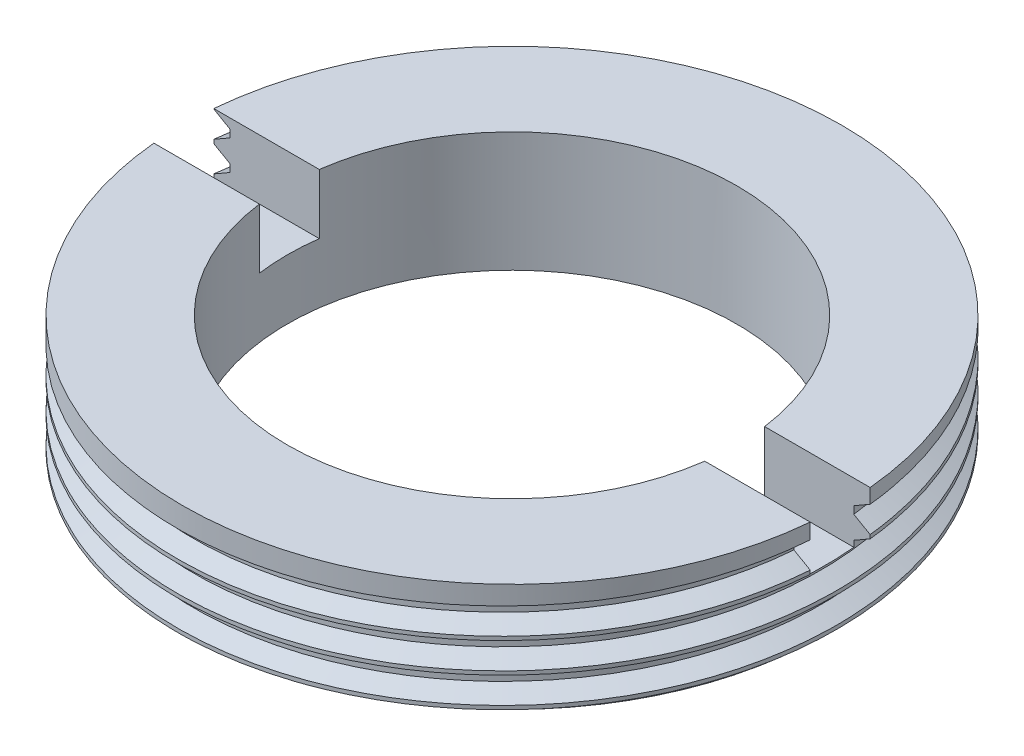
from build123d import *

# Parameters (mm, degrees)
SKETCH_1_R          = 11
SKETCH_1_R_2        = 7.5
EXTRUDE_1_DEPTH     = 4
THREAD_1_PITCH      = 1
SKETCH_4_W          = 24
SKETCH_4_H          = 2
CUT_EXTRUDE_1_DEPTH = 2


with BuildPart() as part:
    # Sketch 1 → Бобышка-Вытянуть1 (new body)
    with BuildSketch(Plane(origin=(0, 0, 0), x_dir=(1, 0, 0), z_dir=(0, 1, 0))):
        with Locations(Location((0, 0, 0), (0, 0, 270))):
            Circle(SKETCH_1_R)
        with Locations(Location((0, 0, 0), (0, 0, 270))):
            Circle(SKETCH_1_R_2, mode=Mode.SUBTRACT)
    extrude(amount=EXTRUDE_1_DEPTH)

    # Резьба1: the profile of Sketch 1 2 profile screwed along a right-hand helix of 4 turns, 8 arcs to a turn; built about Z, then put on its axis
    thread_1_z = Axis((0, 0, 0), (0, 0, 1))
    thread_1_corners = [(11.0003, 0, -0.000173205), (11.0003, 0, 0.875173202), (10.458734125, 0, 0.562499999), (10.458734125, 0, 0.312499999)]
    with BuildLine(mode=Mode.PRIVATE) as thread_1_profile:
        Line(thread_1_corners[0], thread_1_corners[1])
        Line(thread_1_corners[1], thread_1_corners[2])
        Line(thread_1_corners[2], thread_1_corners[3])
        Line(thread_1_corners[3], thread_1_corners[0])
    thread_1_cap = Face(thread_1_profile.wire())
    thread_1_turn_angles = [0, 22.5, 45, 67.5, 90, 112.5, 135, 157.5, 180, 202.5, 225, 247.5, 270, 292.5, 315, 337.5, 360]
    thread_1_turn_weights = [1, 0.9238795325112867, 1, 0.9238795325112867, 1, 0.9238795325112867, 1, 0.9238795325112867, 1, 0.9238795325112867, 1, 0.9238795325112867, 1, 0.9238795325112867, 1, 0.9238795325112867, 1]
    thread_1_turn_rails = [Edge.make_bspline([Vector(p[0], p[1], 0).rotate(thread_1_z, thread_1_turn_angles[k]) / thread_1_turn_weights[k] + Vector(0, 0, p[2] + THREAD_1_PITCH * thread_1_turn_angles[k] / 360) for k in range(17)], [0, 0, 0, 1, 1, 2, 2, 3, 3, 4, 4, 5, 5, 6, 6, 7, 7, 8, 8, 8], 2, thread_1_turn_weights) for p in thread_1_corners]
    thread_1_turn_sides = [Face.make_surface_from_curves(thread_1_turn_rails[p[0]], thread_1_turn_rails[p[1]]) for p in [(0, 1), (1, 2), (2, 3), (3, 0)]]
    thread_1 = Plane(origin=(0, 4, 0), x_dir=(-1, 0, 0), z_dir=(0, -1, 0)) * Solid(Shell([*[p.moved(Location((0, 0, THREAD_1_PITCH * i))) for i in range(4) for p in thread_1_turn_sides], thread_1_cap, thread_1_cap.rotate(thread_1_z, 1440).moved(Location((0, 0, THREAD_1_PITCH * 1440 / 360)))]))
    add(thread_1, mode=Mode.SUBTRACT)

    # Эскиз4 → Вырез-Вытянуть1 (cut)
    with BuildSketch(Plane(origin=(0, 4, 0), x_dir=(1, 0, 0), z_dir=(0, 1, 0))):
        Rectangle(SKETCH_4_W, SKETCH_4_H)
    extrude(amount=-CUT_EXTRUDE_1_DEPTH, mode=Mode.SUBTRACT)


solid = part.part
